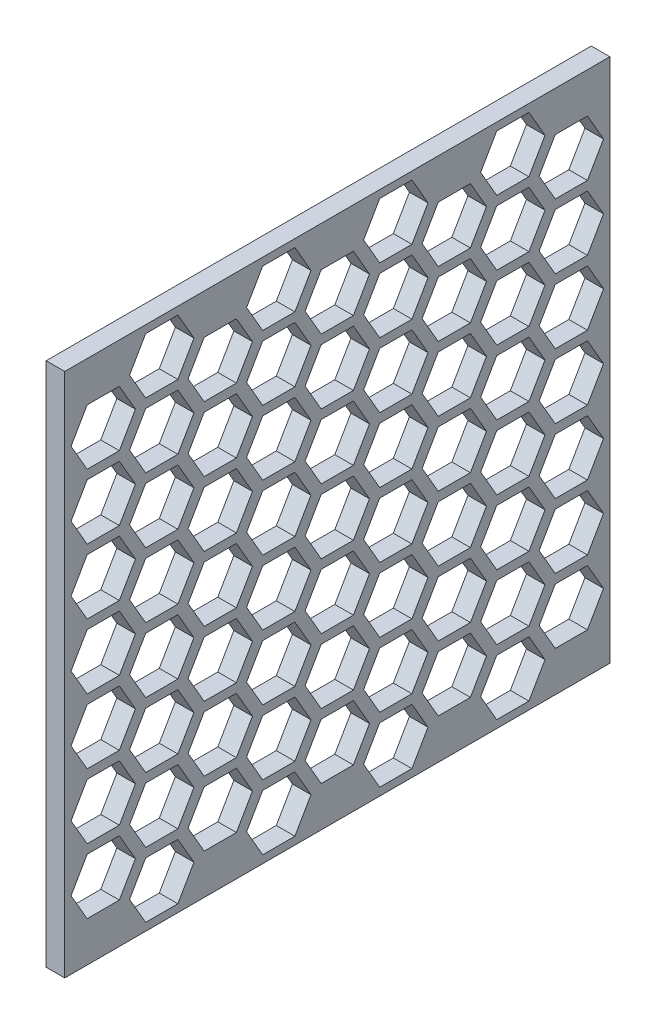
from build123d import *

# Parameters (mm, degrees)
SKETCH1_W           = 84.8
SKETCH1_H           = 3
BOSS_EXTRUDE1_DEPTH = 88
CUT_EXTRUDE1_DEPTH  = 90
FILL_START          = -1.5
FILL_PATTERN1_DEPTH = 3


# Read off the part's stored shape, not the designer's step: Fill Pattern1
with BuildPart() as part:
    # Sketch1 → Boss-Extrude1 (new body)
    with BuildSketch(Plane(origin=(0, 0, 0), x_dir=(0, 1, 0), z_dir=(0, 0, 1))):
        Rectangle(SKETCH1_W, SKETCH1_H)
    extrude(amount=BOSS_EXTRUDE1_DEPTH)

    # Sketch2 → Cut-Extrude1 (cut)
    with BuildSketch(Plane.YZ.offset(1.5)):
        Polygon((4.5, 46.598076211), (0, 49.196152423), (-4.5, 46.598076211), (-4.5, 41.401923789), (0, 38.803847577), (4.5, 41.401923789), align=None)
    extrude(amount=-CUT_EXTRUDE1_DEPTH, mode=Mode.SUBTRACT)

    # Fill Pattern1 outline → Fill Pattern1 (cut)
    with BuildSketch(Plane.YZ.offset(FILL_START)):
        Polygon((0, 1.020276229), (4.5, 3.61835244), (4.5, 8.814504863), (0, 11.412581074), (-4.5, 8.814504863), (-4.5, 3.61835244), align=None)
        Polygon((0, 19.912061903), (4.5, 22.510138114), (4.5, 27.706290537), (0, 30.304366748), (-4.5, 27.706290537), (-4.5, 22.510138114), align=None)
        Polygon((0, 57.695633252), (4.5, 60.293709463), (4.5, 65.489861886), (0, 68.087938097), (-4.5, 65.489861886), (-4.5, 60.293709463), align=None)
        Polygon((0, 76.587418926), (4.5, 79.185495137), (4.5, 84.38164756), (0, 86.979723771), (-4.5, 84.38164756), (-4.5, 79.185495137), align=None)
        Polygon((-36.651607291, 10.466169066), (-32.151607291, 13.064245277), (-32.151607291, 18.2603977), (-36.651607291, 20.858473911), (-41.151607291, 18.2603977), (-41.151607291, 13.064245277), align=None)
        Polygon((-36.651607291, 29.35795474), (-32.151607291, 31.956030952), (-32.151607291, 37.152183374), (-36.651607291, 39.750259586), (-41.151607291, 37.152183374), (-41.151607291, 31.956030952), align=None)
        Polygon((-36.651607291, 48.249740414), (-32.151607291, 50.847816626), (-32.151607291, 56.043969048), (-36.651607291, 58.64204526), (-41.151607291, 56.043969048), (-41.151607291, 50.847816626), align=None)
        Polygon((-36.651607291, 67.141526089), (-32.151607291, 69.7396023), (-32.151607291, 74.935754723), (-36.651607291, 77.533830934), (-41.151607291, 74.935754723), (-41.151607291, 69.7396023), align=None)
        Polygon((-31.415663392, 1.020276229), (-26.915663392, 3.61835244), (-26.915663392, 8.814504863), (-31.415663392, 11.412581074), (-35.915663392, 8.814504863), (-35.915663392, 3.61835244), align=None)
        Polygon((-31.415663392, 19.912061903), (-26.915663392, 22.510138114), (-26.915663392, 27.706290537), (-31.415663392, 30.304366748), (-35.915663392, 27.706290537), (-35.915663392, 22.510138114), align=None)
        Polygon((-31.415663392, 38.803847577), (-26.915663392, 41.401923789), (-26.915663392, 46.598076211), (-31.415663392, 49.196152423), (-35.915663392, 46.598076211), (-35.915663392, 41.401923789), align=None)
        Polygon((-31.415663392, 57.695633252), (-26.915663392, 60.293709463), (-26.915663392, 65.489861886), (-31.415663392, 68.087938097), (-35.915663392, 65.489861886), (-35.915663392, 60.293709463), align=None)
        Polygon((-31.415663392, 76.587418926), (-26.915663392, 79.185495137), (-26.915663392, 84.38164756), (-31.415663392, 86.979723771), (-35.915663392, 84.38164756), (-35.915663392, 79.185495137), align=None)
        Polygon((-26.179719493, 10.466169066), (-21.679719493, 13.064245277), (-21.679719493, 18.2603977), (-26.179719493, 20.858473911), (-30.679719493, 18.2603977), (-30.679719493, 13.064245277), align=None)
        Polygon((-26.179719493, 29.35795474), (-21.679719493, 31.956030952), (-21.679719493, 37.152183374), (-26.179719493, 39.750259586), (-30.679719493, 37.152183374), (-30.679719493, 31.956030952), align=None)
        Polygon((-26.179719493, 48.249740414), (-21.679719493, 50.847816626), (-21.679719493, 56.043969048), (-26.179719493, 58.64204526), (-30.679719493, 56.043969048), (-30.679719493, 50.847816626), align=None)
        Polygon((-26.179719493, 67.141526089), (-21.679719493, 69.7396023), (-21.679719493, 74.935754723), (-26.179719493, 77.533830934), (-30.679719493, 74.935754723), (-30.679719493, 69.7396023), align=None)
        Polygon((-20.943775595, 1.020276229), (-16.443775595, 3.61835244), (-16.443775595, 8.814504863), (-20.943775595, 11.412581074), (-25.443775595, 8.814504863), (-25.443775595, 3.61835244), align=None)
        Polygon((-20.943775595, 19.912061903), (-16.443775595, 22.510138114), (-16.443775595, 27.706290537), (-20.943775595, 30.304366748), (-25.443775595, 27.706290537), (-25.443775595, 22.510138114), align=None)
        Polygon((-20.943775595, 38.803847577), (-16.443775595, 41.401923789), (-16.443775595, 46.598076211), (-20.943775595, 49.196152423), (-25.443775595, 46.598076211), (-25.443775595, 41.401923789), align=None)
        Polygon((-20.943775595, 57.695633252), (-16.443775595, 60.293709463), (-16.443775595, 65.489861886), (-20.943775595, 68.087938097), (-25.443775595, 65.489861886), (-25.443775595, 60.293709463), align=None)
        Polygon((-20.943775595, 76.587418926), (-16.443775595, 79.185495137), (-16.443775595, 84.38164756), (-20.943775595, 86.979723771), (-25.443775595, 84.38164756), (-25.443775595, 79.185495137), align=None)
        Polygon((-15.707831696, 10.466169066), (-11.207831696, 13.064245277), (-11.207831696, 18.2603977), (-15.707831696, 20.858473911), (-20.207831696, 18.2603977), (-20.207831696, 13.064245277), align=None)
        Polygon((-15.707831696, 29.35795474), (-11.207831696, 31.956030952), (-11.207831696, 37.152183374), (-15.707831696, 39.750259586), (-20.207831696, 37.152183374), (-20.207831696, 31.956030952), align=None)
        Polygon((-15.707831696, 48.249740414), (-11.207831696, 50.847816626), (-11.207831696, 56.043969048), (-15.707831696, 58.64204526), (-20.207831696, 56.043969048), (-20.207831696, 50.847816626), align=None)
        Polygon((-15.707831696, 67.141526089), (-11.207831696, 69.7396023), (-11.207831696, 74.935754723), (-15.707831696, 77.533830934), (-20.207831696, 74.935754723), (-20.207831696, 69.7396023), align=None)
        Polygon((-10.471887797, 1.020276229), (-5.971887797, 3.61835244), (-5.971887797, 8.814504863), (-10.471887797, 11.412581074), (-14.971887797, 8.814504863), (-14.971887797, 3.61835244), align=None)
        Polygon((-10.471887797, 19.912061903), (-5.971887797, 22.510138114), (-5.971887797, 27.706290537), (-10.471887797, 30.304366748), (-14.971887797, 27.706290537), (-14.971887797, 22.510138114), align=None)
        Polygon((-10.471887797, 38.803847577), (-5.971887797, 41.401923789), (-5.971887797, 46.598076211), (-10.471887797, 49.196152423), (-14.971887797, 46.598076211), (-14.971887797, 41.401923789), align=None)
        Polygon((-10.471887797, 57.695633252), (-5.971887797, 60.293709463), (-5.971887797, 65.489861886), (-10.471887797, 68.087938097), (-14.971887797, 65.489861886), (-14.971887797, 60.293709463), align=None)
        Polygon((-10.471887797, 76.587418926), (-5.971887797, 79.185495137), (-5.971887797, 84.38164756), (-10.471887797, 86.979723771), (-14.971887797, 84.38164756), (-14.971887797, 79.185495137), align=None)
        Polygon((-5.235943899, 10.466169066), (-0.735943899, 13.064245277), (-0.735943899, 18.2603977), (-5.235943899, 20.858473911), (-9.735943899, 18.2603977), (-9.735943899, 13.064245277), align=None)
        Polygon((-5.235943899, 29.35795474), (-0.735943899, 31.956030952), (-0.735943899, 37.152183374), (-5.235943899, 39.750259586), (-9.735943899, 37.152183374), (-9.735943899, 31.956030952), align=None)
        Polygon((-5.235943899, 48.249740414), (-0.735943899, 50.847816626), (-0.735943899, 56.043969048), (-5.235943899, 58.64204526), (-9.735943899, 56.043969048), (-9.735943899, 50.847816626), align=None)
        Polygon((-5.235943899, 67.141526089), (-0.735943899, 69.7396023), (-0.735943899, 74.935754723), (-5.235943899, 77.533830934), (-9.735943899, 74.935754723), (-9.735943899, 69.7396023), align=None)
        Polygon((5.235943899, 10.466169066), (9.735943899, 13.064245277), (9.735943899, 18.2603977), (5.235943899, 20.858473911), (0.735943899, 18.2603977), (0.735943899, 13.064245277), align=None)
        Polygon((5.235943899, 29.35795474), (9.735943899, 31.956030952), (9.735943899, 37.152183374), (5.235943899, 39.750259586), (0.735943899, 37.152183374), (0.735943899, 31.956030952), align=None)
        Polygon((5.235943899, 48.249740414), (9.735943899, 50.847816626), (9.735943899, 56.043969048), (5.235943899, 58.64204526), (0.735943899, 56.043969048), (0.735943899, 50.847816626), align=None)
        Polygon((5.235943899, 67.141526089), (9.735943899, 69.7396023), (9.735943899, 74.935754723), (5.235943899, 77.533830934), (0.735943899, 74.935754723), (0.735943899, 69.7396023), align=None)
        Polygon((10.471887797, 1.020276229), (14.971887797, 3.61835244), (14.971887797, 8.814504863), (10.471887797, 11.412581074), (5.971887797, 8.814504863), (5.971887797, 3.61835244), align=None)
        Polygon((10.471887797, 19.912061903), (14.971887797, 22.510138114), (14.971887797, 27.706290537), (10.471887797, 30.304366748), (5.971887797, 27.706290537), (5.971887797, 22.510138114), align=None)
        Polygon((10.471887797, 38.803847577), (14.971887797, 41.401923789), (14.971887797, 46.598076211), (10.471887797, 49.196152423), (5.971887797, 46.598076211), (5.971887797, 41.401923789), align=None)
        Polygon((10.471887797, 57.695633252), (14.971887797, 60.293709463), (14.971887797, 65.489861886), (10.471887797, 68.087938097), (5.971887797, 65.489861886), (5.971887797, 60.293709463), align=None)
        Polygon((10.471887797, 76.587418926), (14.971887797, 79.185495137), (14.971887797, 84.38164756), (10.471887797, 86.979723771), (5.971887797, 84.38164756), (5.971887797, 79.185495137), align=None)
        Polygon((15.707831696, 10.466169066), (20.207831696, 13.064245277), (20.207831696, 18.2603977), (15.707831696, 20.858473911), (11.207831696, 18.2603977), (11.207831696, 13.064245277), align=None)
        Polygon((15.707831696, 29.35795474), (20.207831696, 31.956030952), (20.207831696, 37.152183374), (15.707831696, 39.750259586), (11.207831696, 37.152183374), (11.207831696, 31.956030952), align=None)
        Polygon((15.707831696, 48.249740414), (20.207831696, 50.847816626), (20.207831696, 56.043969048), (15.707831696, 58.64204526), (11.207831696, 56.043969048), (11.207831696, 50.847816626), align=None)
        Polygon((15.707831696, 67.141526089), (20.207831696, 69.7396023), (20.207831696, 74.935754723), (15.707831696, 77.533830934), (11.207831696, 74.935754723), (11.207831696, 69.7396023), align=None)
        Polygon((20.943775595, 1.020276229), (25.443775595, 3.61835244), (25.443775595, 8.814504863), (20.943775595, 11.412581074), (16.443775595, 8.814504863), (16.443775595, 3.61835244), align=None)
        Polygon((20.943775595, 19.912061903), (25.443775595, 22.510138114), (25.443775595, 27.706290537), (20.943775595, 30.304366748), (16.443775595, 27.706290537), (16.443775595, 22.510138114), align=None)
        Polygon((20.943775595, 38.803847577), (25.443775595, 41.401923789), (25.443775595, 46.598076211), (20.943775595, 49.196152423), (16.443775595, 46.598076211), (16.443775595, 41.401923789), align=None)
        Polygon((20.943775595, 57.695633252), (25.443775595, 60.293709463), (25.443775595, 65.489861886), (20.943775595, 68.087938097), (16.443775595, 65.489861886), (16.443775595, 60.293709463), align=None)
        Polygon((20.943775595, 76.587418926), (25.443775595, 79.185495137), (25.443775595, 84.38164756), (20.943775595, 86.979723771), (16.443775595, 84.38164756), (16.443775595, 79.185495137), align=None)
        Polygon((26.179719493, 10.466169066), (30.679719493, 13.064245277), (30.679719493, 18.2603977), (26.179719493, 20.858473911), (21.679719493, 18.2603977), (21.679719493, 13.064245277), align=None)
        Polygon((26.179719493, 29.35795474), (30.679719493, 31.956030952), (30.679719493, 37.152183374), (26.179719493, 39.750259586), (21.679719493, 37.152183374), (21.679719493, 31.956030952), align=None)
        Polygon((26.179719493, 48.249740414), (30.679719493, 50.847816626), (30.679719493, 56.043969048), (26.179719493, 58.64204526), (21.679719493, 56.043969048), (21.679719493, 50.847816626), align=None)
        Polygon((26.179719493, 67.141526089), (30.679719493, 69.7396023), (30.679719493, 74.935754723), (26.179719493, 77.533830934), (21.679719493, 74.935754723), (21.679719493, 69.7396023), align=None)
        Polygon((31.415663392, 1.020276229), (35.915663392, 3.61835244), (35.915663392, 8.814504863), (31.415663392, 11.412581074), (26.915663392, 8.814504863), (26.915663392, 3.61835244), align=None)
        Polygon((31.415663392, 19.912061903), (35.915663392, 22.510138114), (35.915663392, 27.706290537), (31.415663392, 30.304366748), (26.915663392, 27.706290537), (26.915663392, 22.510138114), align=None)
        Polygon((31.415663392, 38.803847577), (35.915663392, 41.401923789), (35.915663392, 46.598076211), (31.415663392, 49.196152423), (26.915663392, 46.598076211), (26.915663392, 41.401923789), align=None)
        Polygon((31.415663392, 57.695633252), (35.915663392, 60.293709463), (35.915663392, 65.489861886), (31.415663392, 68.087938097), (26.915663392, 65.489861886), (26.915663392, 60.293709463), align=None)
        Polygon((31.415663392, 76.587418926), (35.915663392, 79.185495137), (35.915663392, 84.38164756), (31.415663392, 86.979723771), (26.915663392, 84.38164756), (26.915663392, 79.185495137), align=None)
        Polygon((36.651607291, 10.466169066), (41.151607291, 13.064245277), (41.151607291, 18.2603977), (36.651607291, 20.858473911), (32.151607291, 18.2603977), (32.151607291, 13.064245277), align=None)
        Polygon((36.651607291, 29.35795474), (41.151607291, 31.956030952), (41.151607291, 37.152183374), (36.651607291, 39.750259586), (32.151607291, 37.152183374), (32.151607291, 31.956030952), align=None)
        Polygon((36.651607291, 48.249740414), (41.151607291, 50.847816626), (41.151607291, 56.043969048), (36.651607291, 58.64204526), (32.151607291, 56.043969048), (32.151607291, 50.847816626), align=None)
        Polygon((36.651607291, 67.141526089), (41.151607291, 69.7396023), (41.151607291, 74.935754723), (36.651607291, 77.533830934), (32.151607291, 74.935754723), (32.151607291, 69.7396023), align=None)
    extrude(amount=FILL_PATTERN1_DEPTH, mode=Mode.SUBTRACT)


solid = part.part
